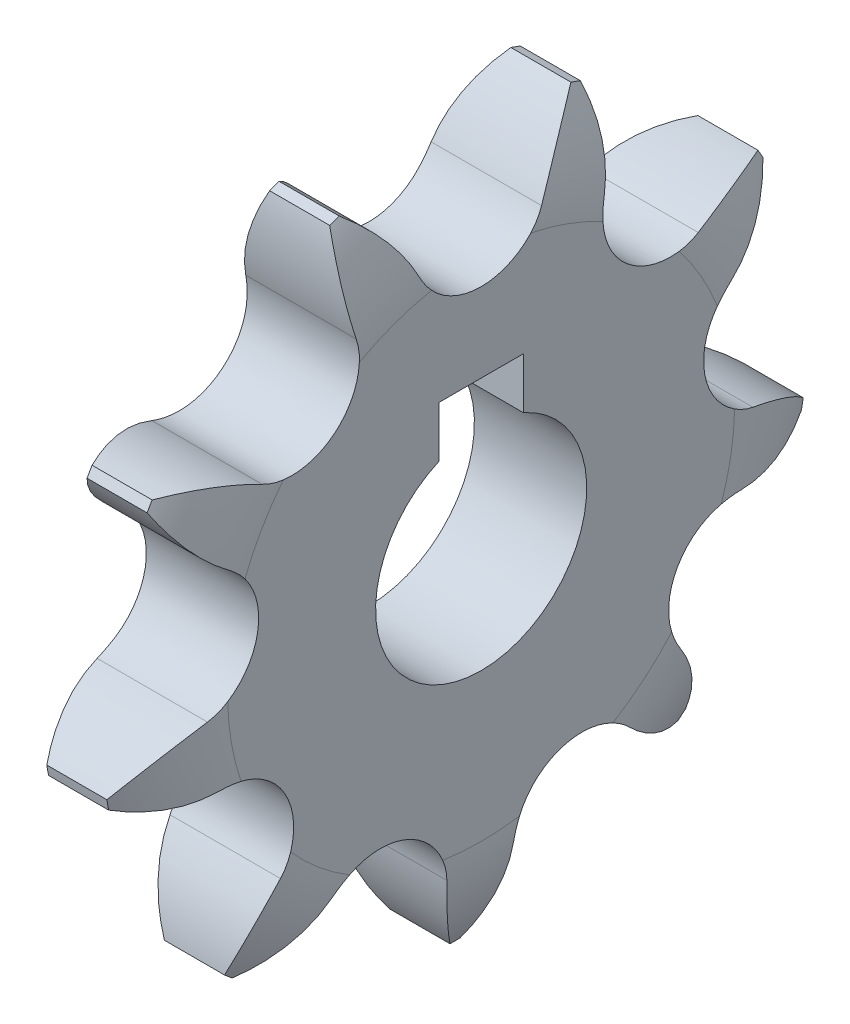
from build123d import *

# Parameters (mm, degrees)
TOOTHCUT_DEPTH      = 25.212835916
TEETHCUTS_COUNT     = 9
TEETHCUTS_ANGLE     = 320
BORSKE_R            = 5
BORE_DEPTH          = 50.0005
SKETCH1_R           = 9
SKETCH1_R_2         = 3
BOSS_EXTRUDE1_DEPTH = 16.6804
CUT_EXTRUDE1_START  = 24
SKETCH2_R           = 5
CUT_EXTRUDE1_DEPTH  = 24
CUT_EXTRUDE2_START  = -22
CUT_EXTRUDE2_DEPTH  = 22
SKETCH4_R           = 12.175934289
CUT_EXTRUDE3_DEPTH  = 16.6804


# Read off the part's stored shape, not the designer's step: Cut-Extrude2
with BuildPart() as part:
    # BasProSke → Base-Revolve (revolve)
    with BuildSketch(Plane(origin=(0, 0, 0), x_dir=(1, 0, 0), z_dir=(0, 1, 0)), mode=Mode.PRIVATE) as base_revolve_sk:
        with BuildLine():
            Line((0, 0), (0, 12.006866982))
            ThreePointArc((0, 12.006866982), (0.314698702, 14.435029868), (1.238, 16.702743471))
            Line((1.238, 16.702743471), (4.0816, 16.702743471))
            ThreePointArc((4.0816, 16.702743471), (5.004901298, 14.435029868), (5.3196, 12.006866982))
            Line((5.3196, 12.006866982), (5.3196, 0))
            Line((5.3196, 0), (0, 0))
        make_face()
    revolve(base_revolve_sk.sketch.rotate(Axis((-10, 0, 0), (1, 0, 0)), 180), axis=Axis((-10, 0, 0), (1, 0, 0)))

    # TooCutSke → ToothCut (cut, through all)
    with BuildSketch(Plane(origin=(0, 0, 0), x_dir=(0, 0, -1), z_dir=(1, 0, 0))):
        with BuildLine():
            ThreePointArc((2.906302496, 12.60113736), (4.198990076, 14.583034398), (5.994051414, 16.124693193))
            ThreePointArc((5.994051414, 16.124693193), (0, 17.202743471), (-5.994051414, 16.124693193))
            ThreePointArc((-5.994051414, 16.124693193), (-4.198990076, 14.583034398), (-2.906302496, 12.60113736))
            ThreePointArc((-2.906302496, 12.60113736), (0, 10.749618471), (2.906302496, 12.60113736))
        make_face()
    toothcut = extrude(amount=TOOTHCUT_DEPTH, mode=Mode.SUBTRACT)

    # TeethCuts: ToothCut ×9 about axis
    teethcuts_axis = Axis((-10, 0, 0), (1, 0, 0))
    for i in range(1, TEETHCUTS_COUNT):
        add(toothcut.rotate(teethcuts_axis, i * TEETHCUTS_ANGLE / (TEETHCUTS_COUNT - 1)), mode=Mode.SUBTRACT)

    # BorSke → Bore (cut, symmetric)
    with BuildSketch(Plane(origin=(0, 0, 0), x_dir=(0, 0, -1), z_dir=(1, 0, 0))):
        with Locations(Location((0, 0, 0), (0, 0, 180))):
            Circle(BORSKE_R)
    extrude(amount=BORE_DEPTH, both=True, mode=Mode.SUBTRACT)

    # Sketch1 → Boss-Extrude1 (add)
    with BuildSketch(Plane(origin=(5.3196, 0, 0), x_dir=(0, 0, -1), z_dir=(1, 0, 0))):
        with Locations(Location((0, 0, 0), (0, 0, 180))):
            Circle(SKETCH1_R)
        Circle(SKETCH1_R_2, mode=Mode.SUBTRACT)
    extrude(amount=BOSS_EXTRUDE1_DEPTH)

    # Sketch2 → Cut-Extrude1 (cut)
    with BuildSketch(Plane(origin=(0, 0, 0), x_dir=(0, 0, -1), z_dir=(1, 0, 0)).offset(CUT_EXTRUDE1_START)):
        Circle(SKETCH2_R)
    extrude(amount=-CUT_EXTRUDE1_DEPTH, mode=Mode.SUBTRACT)

    # Cut-Extrude2 outline → Cut-Extrude2 (cut)
    with BuildSketch(Plane.ZY.offset(CUT_EXTRUDE2_START)):
        with BuildLine():
            Line((2, 4.582575695), (2, 7))
            Line((2, 7), (-2, 7))
            Line((-2, 7), (-2, 4.582575695))
            ThreePointArc((-2, 4.582575695), (0, 5), (2, 4.582575695))
        make_face()
    extrude(amount=CUT_EXTRUDE2_DEPTH, mode=Mode.SUBTRACT)

    # Sketch4 → Cut-Extrude3 (cut)
    with BuildSketch(Plane(origin=(22, 0, 0), x_dir=(0, 0, -1), z_dir=(1, 0, 0))):
        Circle(SKETCH4_R)
    extrude(amount=-CUT_EXTRUDE3_DEPTH, mode=Mode.SUBTRACT)


solid = part.part
